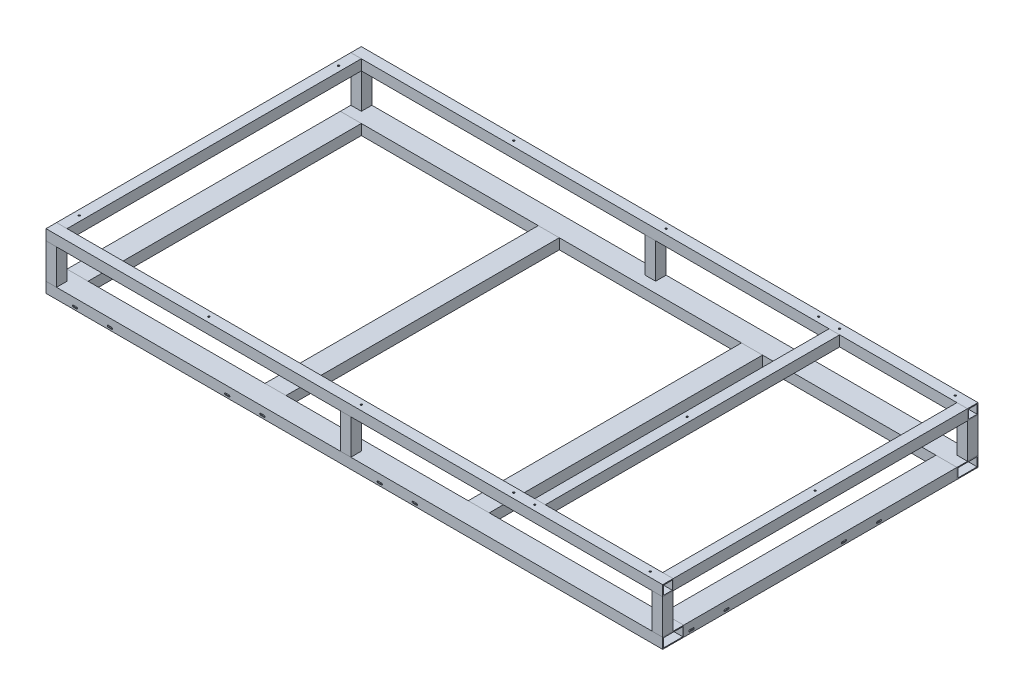
from build123d import *

# Parameters (mm, degrees)
RECTANGULAR_TUBE_1_5_X_3_X_125_2_OUTLIN_W = 76.2
RECTANGULAR_TUBE_1_5_X_3_X_125_2_OUTLIN_H = 990.6
RECTANGULAR_TUBE_1_5_X_3_X_125_2_DEPTH    = 3.175
RECTANGULAR_START                         = 34.925
RECTANGULAR_TUBE_1_5_X_3_X_125_2_2_OUTL_W = 76.2
RECTANGULAR_TUBE_1_5_X_3_X_125_2_2_OUTL_H = 990.6
RECTANGULAR_TUBE_1_5_X_3_X_125_2_2_DEPTH  = 3.175
RECTANGULAR_START_2                       = 3.175
RECTANGULAR_TUBE_1_5_X_3_X_125_2_3_OUTL_W = 3.175
RECTANGULAR_TUBE_1_5_X_3_X_125_2_3_OUTL_H = 990.6
RECTANGULAR_TUBE_1_5_X_3_X_125_2_3_DEPTH  = 31.75
RECTANGULAR_TUBE_1_5_X_3_X_125_2_4_OUTL_W = 76.2
RECTANGULAR_TUBE_1_5_X_3_X_125_2_4_OUTL_H = 990.6
RECTANGULAR_TUBE_1_5_X_3_X_125_2_4_DEPTH  = 3.175
RECTANGULAR_TUBE_1_5_X_3_X_125_2_5_OUTL_W = 76.2
RECTANGULAR_TUBE_1_5_X_3_X_125_2_5_OUTL_H = 990.6
RECTANGULAR_TUBE_1_5_X_3_X_125_2_5_DEPTH  = 3.175
RECTANGULAR_TUBE_1_5_X_3_X_125_2_6_OUTL_W = 3.175
RECTANGULAR_TUBE_1_5_X_3_X_125_2_6_OUTL_H = 990.6
RECTANGULAR_TUBE_1_5_X_3_X_125_2_6_DEPTH  = 31.75
RECTANGULAR_TUBE_1_5_X_3_X_125_2_7_OUTL_W = 2235.2
RECTANGULAR_TUBE_1_5_X_3_X_125_2_7_OUTL_H = 76.2
RECTANGULAR_TUBE_1_5_X_3_X_125_2_7_DEPTH  = 3.175
RECTANGULAR_TUBE_1_5_X_3_X_125_2_8_OUTL_W = 2235.2
RECTANGULAR_TUBE_1_5_X_3_X_125_2_8_OUTL_H = 76.2
RECTANGULAR_TUBE_1_5_X_3_X_125_2_8_DEPTH  = 3.175
RECTANGULAR_TUBE_1_5_X_3_X_125_2_9_OUTL_W = 2235.2
RECTANGULAR_TUBE_1_5_X_3_X_125_2_9_OUTL_H = 3.175
RECTANGULAR_TUBE_1_5_X_3_X_125_2_9_DEPTH  = 31.75
RECTANGULAR_TUBE_1_5_X_3_X_125_2_10_OUT_W = 2235.2
RECTANGULAR_TUBE_1_5_X_3_X_125_2_10_OUT_H = 76.2
RECTANGULAR_TUBE_1_5_X_3_X_125_2_10_DEPTH = 3.175
RECTANGULAR_TUBE_1_5_X_3_X_125_2_11_OUT_W = 2235.2
RECTANGULAR_TUBE_1_5_X_3_X_125_2_11_OUT_H = 76.2
RECTANGULAR_TUBE_1_5_X_3_X_125_2_11_DEPTH = 3.175
RECTANGULAR_TUBE_1_5_X_3_X_125_2_12_OUT_W = 2235.2
RECTANGULAR_TUBE_1_5_X_3_X_125_2_12_OUT_H = 3.175
RECTANGULAR_TUBE_1_5_X_3_X_125_2_12_DEPTH = 31.75
SQUARE_START                              = 533.4
SQUARE_TUBE_1_5_X_1_5_X_125_5_OUTLINE_W   = 2235.2
SQUARE_TUBE_1_5_X_1_5_X_125_5_OUTLINE_H   = 3.175
SQUARE_TUBE_1_5_X_1_5_X_125_5_DEPTH       = 38.1
SQUARE_TUBE_1_5_X_1_5_X_125_5_2_OUTLINE_W = 2235.2
SQUARE_TUBE_1_5_X_1_5_X_125_5_2_OUTLINE_H = 31.75
SQUARE_TUBE_1_5_X_1_5_X_125_5_2_DEPTH     = 3.175
SQUARE_START_2                            = 568.325
SQUARE_TUBE_1_5_X_1_5_X_125_5_3_OUTLINE_W = 2235.2
SQUARE_TUBE_1_5_X_1_5_X_125_5_3_OUTLINE_H = 31.75
SQUARE_TUBE_1_5_X_1_5_X_125_5_3_DEPTH     = 3.175
SQUARE_START_3                            = -1117.6
SQUARE_TUBE_1_5_X_1_5_X_125_5_4_OUTLINE_W = 3.175
SQUARE_TUBE_1_5_X_1_5_X_125_5_4_OUTLINE_H = 1066.8
SQUARE_TUBE_1_5_X_1_5_X_125_5_4_DEPTH     = 38.1
SQUARE_TUBE_1_5_X_1_5_X_125_5_5_OUTLINE_W = 31.75
SQUARE_TUBE_1_5_X_1_5_X_125_5_5_OUTLINE_H = 1066.8
SQUARE_TUBE_1_5_X_1_5_X_125_5_5_DEPTH     = 3.175
SQUARE_START_4                            = -1082.675
SQUARE_TUBE_1_5_X_1_5_X_125_5_6_OUTLINE_W = 31.75
SQUARE_TUBE_1_5_X_1_5_X_125_5_6_OUTLINE_H = 1066.8
SQUARE_TUBE_1_5_X_1_5_X_125_5_6_DEPTH     = 3.175
SQUARE_START_5                            = 1079.5
SQUARE_TUBE_1_5_X_1_5_X_125_5_7_OUTLINE_W = 3.175
SQUARE_TUBE_1_5_X_1_5_X_125_5_7_OUTLINE_H = 1066.8
SQUARE_TUBE_1_5_X_1_5_X_125_5_7_DEPTH     = 38.1
SQUARE_TUBE_1_5_X_1_5_X_125_5_8_OUTLINE_W = 31.75
SQUARE_TUBE_1_5_X_1_5_X_125_5_8_OUTLINE_H = 1066.8
SQUARE_TUBE_1_5_X_1_5_X_125_5_8_DEPTH     = 3.175
SQUARE_START_6                            = 1114.425
SQUARE_TUBE_1_5_X_1_5_X_125_5_9_OUTLINE_W = 31.75
SQUARE_TUBE_1_5_X_1_5_X_125_5_9_OUTLINE_H = 1066.8
SQUARE_TUBE_1_5_X_1_5_X_125_5_9_DEPTH     = 3.175
SQUARE_START_7                            = -571.5
SQUARE_TUBE_1_5_X_1_5_X_125_5_10_OUTLIN_W = 2235.2
SQUARE_TUBE_1_5_X_1_5_X_125_5_10_OUTLIN_H = 3.175
SQUARE_TUBE_1_5_X_1_5_X_125_5_10_DEPTH    = 38.1
SQUARE_TUBE_1_5_X_1_5_X_125_5_11_OUTLIN_W = 2235.2
SQUARE_TUBE_1_5_X_1_5_X_125_5_11_OUTLIN_H = 31.75
SQUARE_TUBE_1_5_X_1_5_X_125_5_11_DEPTH    = 3.175
SQUARE_START_8                            = -536.575
SQUARE_TUBE_1_5_X_1_5_X_125_5_12_OUTLIN_W = 2235.2
SQUARE_TUBE_1_5_X_1_5_X_125_5_12_OUTLIN_H = 31.75
SQUARE_TUBE_1_5_X_1_5_X_125_5_12_DEPTH    = 3.175
SKETCH112_W                               = 38.1
SKETCH112_H                               = 38.1
SKETCH112_W_2                             = 31.75
SKETCH112_H_2                             = 31.75
SQUARE_TUBE_1_5_X_1_5_X_125_6_DEPTH       = 203.2
SKETCH113_W                               = 38.1
SKETCH113_H                               = 38.1
SKETCH113_W_2                             = 31.75
SKETCH113_H_2                             = 31.75
SQUARE_TUBE_1_5_X_1_5_X_125_7_DEPTH       = 203.2
SKETCH114_W                               = 38.1
SKETCH114_H                               = 38.1
SKETCH114_W_2                             = 31.75
SKETCH114_H_2                             = 31.75
SQUARE_TUBE_1_5_X_1_5_X_125_8_DEPTH       = 203.2
SKETCH115_W                               = 38.1
SKETCH115_H                               = 38.1
SKETCH115_W_2                             = 31.75
SKETCH115_H_2                             = 31.75
SQUARE_TUBE_1_5_X_1_5_X_125_9_DEPTH       = 203.2
SKETCH127_W                               = 38.1
SKETCH127_H                               = 38.1
SKETCH127_W_2                             = 31.75
SKETCH127_H_2                             = 31.75
SQUARE_TUBE_1_5_X_1_5_X_125_32_DEPTH      = 1066.8
F_START                                   = 165.1
F_0_257_DIAMETER_HOLE1_OUTLINE_R          = 3.2639
F_0_257_DIAMETER_HOLE1_DEPTH              = 38.1
SKETCH151_W                               = 38.1
SKETCH151_H                               = 76.2
SKETCH151_W_2                             = 31.75
SKETCH151_H_2                             = 69.85
RECTANGULAR_TUBE_1_5_X_3_X_125_1_DEPTH    = 990.6
SKETCH151_ON_SEGMENT_2_W                  = 38.1
SKETCH151_ON_SEGMENT_2_H                  = 76.2
SKETCH151_ON_SEGMENT_2_W_2                = 31.75
SKETCH151_ON_SEGMENT_2_H_2                = 69.85
RECTANGULAR_TUBE_1_5_X_3_X_125_1_2_DEPTH  = 990.6
SKETCH157_W                               = 38.1
SKETCH157_H                               = 38.1
SKETCH157_W_2                             = 31.75
SKETCH157_H_2                             = 31.75
SQUARE_TUBE_1_5_X_1_5_X_125_96_DEPTH      = 127
F_0_257_START                             = 568.325
F_0_257_DIAMETER_HOLE1_2_DEPTH            = 3.175
F_START_2                                 = 1114.425
F_0_257_DIAMETER_SLOT4_DEPTH              = 3.175


# Read off the part's stored shape, not the designer's step: Rectangular tube 1.5 X 3 X .125_2_, Square tube 1.5 X 1.5 X .125_5_, F _0.257_ Diameter Hole1,  _0.257_ Diameter Hole1, F _0.257_ Diameter Slot4
with BuildPart() as part:
    # Rectangular tube 1.5 X 3 X .125(2) outlin → Rectangular tube 1.5 X 3 X .125(2) (new body)
    with BuildSketch(Plane(origin=(0, 0, 0), x_dir=(1, 0, 0), z_dir=(0, 1, 0))):
        with Locations((1079.5, 0)):
            Rectangle(RECTANGULAR_TUBE_1_5_X_3_X_125_2_OUTLIN_W, RECTANGULAR_TUBE_1_5_X_3_X_125_2_OUTLIN_H)
    extrude(amount=RECTANGULAR_TUBE_1_5_X_3_X_125_2_DEPTH)

    # Rectangular tube 1.5 X 3 X .125_2 2 outl → Rectangular tube 1.5 X 3 X .125_2 2 (add)
    with BuildSketch(Plane(origin=(0, 0, 0), x_dir=(1, 0, 0), z_dir=(0, 1, 0)).offset(RECTANGULAR_START)):
        with Locations((1079.5, 0)):
            Rectangle(RECTANGULAR_TUBE_1_5_X_3_X_125_2_2_OUTL_W, RECTANGULAR_TUBE_1_5_X_3_X_125_2_2_OUTL_H)
    extrude(amount=RECTANGULAR_TUBE_1_5_X_3_X_125_2_2_DEPTH)

    # Rectangular tube 1.5 X 3 X .125_2 3 outl → Rectangular tube 1.5 X 3 X .125_2 3 (add)
    with BuildSketch(Plane(origin=(0, 0, 0), x_dir=(1, 0, 0), z_dir=(0, 1, 0)).offset(RECTANGULAR_START_2)):
        with Locations((1042.9875, 0)):
            Rectangle(RECTANGULAR_TUBE_1_5_X_3_X_125_2_3_OUTL_W, RECTANGULAR_TUBE_1_5_X_3_X_125_2_3_OUTL_H)
        with Locations((1116.0125, 0)):
            Rectangle(RECTANGULAR_TUBE_1_5_X_3_X_125_2_3_OUTL_W, RECTANGULAR_TUBE_1_5_X_3_X_125_2_3_OUTL_H)
    extrude(amount=RECTANGULAR_TUBE_1_5_X_3_X_125_2_3_DEPTH)

    # F (0.257) Diameter Slot4 outline → F (0.257) Diameter Slot4 (cut)
    with BuildSketch(Plane.YZ.offset(F_START_2)):
        with BuildLine():
            Line((12.7889, -218.9861), (12.7889, -206.4639))
            ThreePointArc((12.7889, -206.4639), (9.525, -203.2), (6.2611, -206.4639))
            Line((6.2611, -206.4639), (6.2611, -218.9861))
            ThreePointArc((6.2611, -218.9861), (9.525, -222.25), (12.7889, -218.9861))
        make_face()
        with BuildLine():
            ThreePointArc((12.7889, -79.4639), (9.525, -76.2), (6.2611, -79.4639))
            Line((6.2611, -79.4639), (6.2611, -91.9861))
            ThreePointArc((6.2611, -91.9861), (9.525, -95.25), (12.7889, -91.9861))
            Line((12.7889, -91.9861), (12.7889, -79.4639))
        make_face()
        with BuildLine():
            ThreePointArc((12.7889, 472.9861), (9.525, 476.25), (6.2611, 472.9861))
            Line((6.2611, 472.9861), (6.2611, 460.4639))
            ThreePointArc((6.2611, 460.4639), (9.525, 457.2), (12.7889, 460.4639))
            Line((12.7889, 460.4639), (12.7889, 472.9861))
        make_face()
        with BuildLine():
            ThreePointArc((12.7889, 345.9861), (9.525, 349.25), (6.2611, 345.9861))
            Line((6.2611, 345.9861), (6.2611, 333.4639))
            ThreePointArc((6.2611, 333.4639), (9.525, 330.2), (12.7889, 333.4639))
            Line((12.7889, 333.4639), (12.7889, 345.9861))
        make_face()
    extrude(amount=F_0_257_DIAMETER_SLOT4_DEPTH, mode=Mode.SUBTRACT)


with BuildPart() as body_2:
    # Rectangular tube 1.5 X 3 X .125_2 4 outl → Rectangular tube 1.5 X 3 X .125_2 4 (new body)
    with BuildSketch(Plane(origin=(0, 0, 0), x_dir=(1, 0, 0), z_dir=(0, 1, 0))):
        with Locations((-1079.5, 0)):
            Rectangle(RECTANGULAR_TUBE_1_5_X_3_X_125_2_4_OUTL_W, RECTANGULAR_TUBE_1_5_X_3_X_125_2_4_OUTL_H)
    extrude(amount=RECTANGULAR_TUBE_1_5_X_3_X_125_2_4_DEPTH)

    # Rectangular tube 1.5 X 3 X .125_2 5 outl → Rectangular tube 1.5 X 3 X .125_2 5 (add)
    with BuildSketch(Plane(origin=(0, 0, 0), x_dir=(1, 0, 0), z_dir=(0, 1, 0)).offset(RECTANGULAR_START)):
        with Locations((-1079.5, 0)):
            Rectangle(RECTANGULAR_TUBE_1_5_X_3_X_125_2_5_OUTL_W, RECTANGULAR_TUBE_1_5_X_3_X_125_2_5_OUTL_H)
    extrude(amount=RECTANGULAR_TUBE_1_5_X_3_X_125_2_5_DEPTH)

    # Rectangular tube 1.5 X 3 X .125_2 6 outl → Rectangular tube 1.5 X 3 X .125_2 6 (add)
    with BuildSketch(Plane(origin=(0, 0, 0), x_dir=(1, 0, 0), z_dir=(0, 1, 0)).offset(RECTANGULAR_START_2)):
        with Locations((-1042.9875, 0)):
            Rectangle(RECTANGULAR_TUBE_1_5_X_3_X_125_2_6_OUTL_W, RECTANGULAR_TUBE_1_5_X_3_X_125_2_6_OUTL_H)
        with Locations((-1116.0125, 0)):
            Rectangle(RECTANGULAR_TUBE_1_5_X_3_X_125_2_6_OUTL_W, RECTANGULAR_TUBE_1_5_X_3_X_125_2_6_OUTL_H)
    extrude(amount=RECTANGULAR_TUBE_1_5_X_3_X_125_2_6_DEPTH)


with BuildPart() as body_3:
    # Rectangular tube 1.5 X 3 X .125_2 7 outl → Rectangular tube 1.5 X 3 X .125_2 7 (new body)
    with BuildSketch(Plane(origin=(0, 0, 0), x_dir=(1, 0, 0), z_dir=(0, 1, 0))):
        with Locations((0, 533.4)):
            Rectangle(RECTANGULAR_TUBE_1_5_X_3_X_125_2_7_OUTL_W, RECTANGULAR_TUBE_1_5_X_3_X_125_2_7_OUTL_H)
    extrude(amount=RECTANGULAR_TUBE_1_5_X_3_X_125_2_7_DEPTH)

    # Rectangular tube 1.5 X 3 X .125_2 8 outl → Rectangular tube 1.5 X 3 X .125_2 8 (add)
    with BuildSketch(Plane(origin=(0, 0, 0), x_dir=(1, 0, 0), z_dir=(0, 1, 0)).offset(RECTANGULAR_START)):
        with Locations((0, 533.4)):
            Rectangle(RECTANGULAR_TUBE_1_5_X_3_X_125_2_8_OUTL_W, RECTANGULAR_TUBE_1_5_X_3_X_125_2_8_OUTL_H)
    extrude(amount=RECTANGULAR_TUBE_1_5_X_3_X_125_2_8_DEPTH)

    # Rectangular tube 1.5 X 3 X .125_2 9 outl → Rectangular tube 1.5 X 3 X .125_2 9 (add)
    with BuildSketch(Plane(origin=(0, 0, 0), x_dir=(1, 0, 0), z_dir=(0, 1, 0)).offset(RECTANGULAR_START_2)):
        with Locations((0, 496.8875)):
            Rectangle(RECTANGULAR_TUBE_1_5_X_3_X_125_2_9_OUTL_W, RECTANGULAR_TUBE_1_5_X_3_X_125_2_9_OUTL_H)
        with Locations((0, 569.9125)):
            Rectangle(RECTANGULAR_TUBE_1_5_X_3_X_125_2_9_OUTL_W, RECTANGULAR_TUBE_1_5_X_3_X_125_2_9_OUTL_H)
    extrude(amount=RECTANGULAR_TUBE_1_5_X_3_X_125_2_9_DEPTH)


with BuildPart() as body_4:
    # Rectangular tube 1.5 X 3 X .125_2 10 out → Rectangular tube 1.5 X 3 X .125_2 10 (new body)
    with BuildSketch(Plane(origin=(0, 0, 0), x_dir=(1, 0, 0), z_dir=(0, 1, 0))):
        with Locations((0, -533.4)):
            Rectangle(RECTANGULAR_TUBE_1_5_X_3_X_125_2_10_OUT_W, RECTANGULAR_TUBE_1_5_X_3_X_125_2_10_OUT_H)
    extrude(amount=RECTANGULAR_TUBE_1_5_X_3_X_125_2_10_DEPTH)

    # Rectangular tube 1.5 X 3 X .125_2 11 out → Rectangular tube 1.5 X 3 X .125_2 11 (add)
    with BuildSketch(Plane(origin=(0, 0, 0), x_dir=(1, 0, 0), z_dir=(0, 1, 0)).offset(RECTANGULAR_START)):
        with Locations((0, -533.4)):
            Rectangle(RECTANGULAR_TUBE_1_5_X_3_X_125_2_11_OUT_W, RECTANGULAR_TUBE_1_5_X_3_X_125_2_11_OUT_H)
    extrude(amount=RECTANGULAR_TUBE_1_5_X_3_X_125_2_11_DEPTH)

    # Rectangular tube 1.5 X 3 X .125_2 12 out → Rectangular tube 1.5 X 3 X .125_2 12 (add)
    with BuildSketch(Plane(origin=(0, 0, 0), x_dir=(1, 0, 0), z_dir=(0, 1, 0)).offset(RECTANGULAR_START_2)):
        with Locations((0, -496.8875)):
            Rectangle(RECTANGULAR_TUBE_1_5_X_3_X_125_2_12_OUT_W, RECTANGULAR_TUBE_1_5_X_3_X_125_2_12_OUT_H)
        with Locations((0, -569.9125)):
            Rectangle(RECTANGULAR_TUBE_1_5_X_3_X_125_2_12_OUT_W, RECTANGULAR_TUBE_1_5_X_3_X_125_2_12_OUT_H)
    extrude(amount=RECTANGULAR_TUBE_1_5_X_3_X_125_2_12_DEPTH)

    # 0.257_ Diameter Hole1 2 outline → 0.257_ Diameter Hole1 2 (cut)
    with BuildSketch(Plane.XY.offset(F_0_257_START)):
        with BuildLine():
            Line((212.8139, 6.2611), (225.3361, 6.2611))
            ThreePointArc((225.3361, 6.2611), (228.6, 9.525), (225.3361, 12.7889))
            Line((225.3361, 12.7889), (212.8139, 12.7889))
            ThreePointArc((212.8139, 12.7889), (209.55, 9.525), (212.8139, 6.2611))
        make_face()
        with BuildLine():
            ThreePointArc((98.3361, 6.2611), (101.6, 9.525), (98.3361, 12.7889))
            Line((98.3361, 12.7889), (85.8139, 12.7889))
            ThreePointArc((85.8139, 12.7889), (82.55, 9.525), (85.8139, 6.2611))
            Line((85.8139, 6.2611), (98.3361, 6.2611))
        make_face()
        with BuildLine():
            ThreePointArc((-327.1139, 6.2611), (-323.85, 9.525), (-327.1139, 12.7889))
            Line((-327.1139, 12.7889), (-339.6361, 12.7889))
            ThreePointArc((-339.6361, 12.7889), (-342.9, 9.525), (-339.6361, 6.2611))
            Line((-339.6361, 6.2611), (-327.1139, 6.2611))
        make_face()
        with BuildLine():
            ThreePointArc((-454.1139, 6.2611), (-450.85, 9.525), (-454.1139, 12.7889))
            Line((-454.1139, 12.7889), (-466.6361, 12.7889))
            ThreePointArc((-466.6361, 12.7889), (-469.9, 9.525), (-466.6361, 6.2611))
            Line((-466.6361, 6.2611), (-454.1139, 6.2611))
        make_face()
        with BuildLine():
            ThreePointArc((-879.5639, 6.2611), (-876.3, 9.525), (-879.5639, 12.7889))
            Line((-879.5639, 12.7889), (-892.0861, 12.7889))
            ThreePointArc((-892.0861, 12.7889), (-895.35, 9.525), (-892.0861, 6.2611))
            Line((-892.0861, 6.2611), (-879.5639, 6.2611))
        make_face()
        with BuildLine():
            ThreePointArc((-1006.5639, 6.2611), (-1003.3, 9.525), (-1006.5639, 12.7889))
            Line((-1006.5639, 12.7889), (-1019.0861, 12.7889))
            ThreePointArc((-1019.0861, 12.7889), (-1022.35, 9.525), (-1019.0861, 6.2611))
            Line((-1019.0861, 6.2611), (-1006.5639, 6.2611))
        make_face()
    f_0_257_diameter_hole1_2 = extrude(amount=F_0_257_DIAMETER_HOLE1_2_DEPTH, mode=Mode.SUBTRACT)


with BuildPart() as body_5:
    # Square tube 1.5 X 1.5 X .125(5) outline → Square tube 1.5 X 1.5 X .125(5) (new body)
    with BuildSketch(Plane.XY.offset(SQUARE_START)):
        with Locations((0, 201.6125)):
            Rectangle(SQUARE_TUBE_1_5_X_1_5_X_125_5_OUTLINE_W, SQUARE_TUBE_1_5_X_1_5_X_125_5_OUTLINE_H)
        with Locations((0, 166.6875)):
            Rectangle(SQUARE_TUBE_1_5_X_1_5_X_125_5_OUTLINE_W, SQUARE_TUBE_1_5_X_1_5_X_125_5_OUTLINE_H)
    extrude(amount=SQUARE_TUBE_1_5_X_1_5_X_125_5_DEPTH)

    # Square tube 1.5 X 1.5 X .125_5 2 outline → Square tube 1.5 X 1.5 X .125_5 2 (add)
    with BuildSketch(Plane.XY.offset(SQUARE_START)):
        with Locations((0, 184.15)):
            Rectangle(SQUARE_TUBE_1_5_X_1_5_X_125_5_2_OUTLINE_W, SQUARE_TUBE_1_5_X_1_5_X_125_5_2_OUTLINE_H)
    extrude(amount=SQUARE_TUBE_1_5_X_1_5_X_125_5_2_DEPTH)

    # Square tube 1.5 X 1.5 X .125_5 3 outline → Square tube 1.5 X 1.5 X .125_5 3 (add)
    with BuildSketch(Plane.XY.offset(SQUARE_START_2)):
        with Locations((0, 184.15)):
            Rectangle(SQUARE_TUBE_1_5_X_1_5_X_125_5_3_OUTLINE_W, SQUARE_TUBE_1_5_X_1_5_X_125_5_3_OUTLINE_H)
    extrude(amount=SQUARE_TUBE_1_5_X_1_5_X_125_5_3_DEPTH)


with BuildPart() as body_6:
    # Square tube 1.5 X 1.5 X .125_5 4 outline → Square tube 1.5 X 1.5 X .125_5 4 (new body)
    with BuildSketch(Plane.YZ.offset(SQUARE_START_3)):
        with Locations((166.6875, 0)):
            Rectangle(SQUARE_TUBE_1_5_X_1_5_X_125_5_4_OUTLINE_W, SQUARE_TUBE_1_5_X_1_5_X_125_5_4_OUTLINE_H)
        with Locations((201.6125, 0)):
            Rectangle(SQUARE_TUBE_1_5_X_1_5_X_125_5_4_OUTLINE_W, SQUARE_TUBE_1_5_X_1_5_X_125_5_4_OUTLINE_H)
    extrude(amount=SQUARE_TUBE_1_5_X_1_5_X_125_5_4_DEPTH)

    # Square tube 1.5 X 1.5 X .125_5 5 outline → Square tube 1.5 X 1.5 X .125_5 5 (add)
    with BuildSketch(Plane.YZ.offset(SQUARE_START_3)):
        with Locations((184.15, 0)):
            Rectangle(SQUARE_TUBE_1_5_X_1_5_X_125_5_5_OUTLINE_W, SQUARE_TUBE_1_5_X_1_5_X_125_5_5_OUTLINE_H)
    extrude(amount=SQUARE_TUBE_1_5_X_1_5_X_125_5_5_DEPTH)

    # Square tube 1.5 X 1.5 X .125_5 6 outline → Square tube 1.5 X 1.5 X .125_5 6 (add)
    with BuildSketch(Plane.YZ.offset(SQUARE_START_4)):
        with Locations((184.15, 0)):
            Rectangle(SQUARE_TUBE_1_5_X_1_5_X_125_5_6_OUTLINE_W, SQUARE_TUBE_1_5_X_1_5_X_125_5_6_OUTLINE_H)
    extrude(amount=SQUARE_TUBE_1_5_X_1_5_X_125_5_6_DEPTH)


with BuildPart() as body_7:
    # Square tube 1.5 X 1.5 X .125_5 7 outline → Square tube 1.5 X 1.5 X .125_5 7 (new body)
    with BuildSketch(Plane.YZ.offset(SQUARE_START_5)):
        with Locations((166.6875, 0)):
            Rectangle(SQUARE_TUBE_1_5_X_1_5_X_125_5_7_OUTLINE_W, SQUARE_TUBE_1_5_X_1_5_X_125_5_7_OUTLINE_H)
        with Locations((201.6125, 0)):
            Rectangle(SQUARE_TUBE_1_5_X_1_5_X_125_5_7_OUTLINE_W, SQUARE_TUBE_1_5_X_1_5_X_125_5_7_OUTLINE_H)
    extrude(amount=SQUARE_TUBE_1_5_X_1_5_X_125_5_7_DEPTH)

    # Square tube 1.5 X 1.5 X .125_5 8 outline → Square tube 1.5 X 1.5 X .125_5 8 (add)
    with BuildSketch(Plane.YZ.offset(SQUARE_START_5)):
        with Locations((184.15, 0)):
            Rectangle(SQUARE_TUBE_1_5_X_1_5_X_125_5_8_OUTLINE_W, SQUARE_TUBE_1_5_X_1_5_X_125_5_8_OUTLINE_H)
    extrude(amount=SQUARE_TUBE_1_5_X_1_5_X_125_5_8_DEPTH)

    # Square tube 1.5 X 1.5 X .125_5 9 outline → Square tube 1.5 X 1.5 X .125_5 9 (add)
    with BuildSketch(Plane.YZ.offset(SQUARE_START_6)):
        with Locations((184.15, 0)):
            Rectangle(SQUARE_TUBE_1_5_X_1_5_X_125_5_9_OUTLINE_W, SQUARE_TUBE_1_5_X_1_5_X_125_5_9_OUTLINE_H)
    extrude(amount=SQUARE_TUBE_1_5_X_1_5_X_125_5_9_DEPTH)


with BuildPart() as body_8:
    # Square tube 1.5 X 1.5 X .125_5 10 outlin → Square tube 1.5 X 1.5 X .125_5 10 (new body)
    with BuildSketch(Plane.XY.offset(SQUARE_START_7)):
        with Locations((0, 201.6125)):
            Rectangle(SQUARE_TUBE_1_5_X_1_5_X_125_5_10_OUTLIN_W, SQUARE_TUBE_1_5_X_1_5_X_125_5_10_OUTLIN_H)
        with Locations((0, 166.6875)):
            Rectangle(SQUARE_TUBE_1_5_X_1_5_X_125_5_10_OUTLIN_W, SQUARE_TUBE_1_5_X_1_5_X_125_5_10_OUTLIN_H)
    extrude(amount=SQUARE_TUBE_1_5_X_1_5_X_125_5_10_DEPTH)

    # Square tube 1.5 X 1.5 X .125_5 11 outlin → Square tube 1.5 X 1.5 X .125_5 11 (add)
    with BuildSketch(Plane.XY.offset(SQUARE_START_7)):
        with Locations((0, 184.15)):
            Rectangle(SQUARE_TUBE_1_5_X_1_5_X_125_5_11_OUTLIN_W, SQUARE_TUBE_1_5_X_1_5_X_125_5_11_OUTLIN_H)
    extrude(amount=SQUARE_TUBE_1_5_X_1_5_X_125_5_11_DEPTH)

    # Square tube 1.5 X 1.5 X .125_5 12 outlin → Square tube 1.5 X 1.5 X .125_5 12 (add)
    with BuildSketch(Plane.XY.offset(SQUARE_START_8)):
        with Locations((0, 184.15)):
            Rectangle(SQUARE_TUBE_1_5_X_1_5_X_125_5_12_OUTLIN_W, SQUARE_TUBE_1_5_X_1_5_X_125_5_12_OUTLIN_H)
    extrude(amount=SQUARE_TUBE_1_5_X_1_5_X_125_5_12_DEPTH)


with BuildPart() as body_9:
    # Sketch112 → Square tube 1.5 X 1.5 X .125(6) (new body)
    with BuildSketch(Plane(origin=(-1098.55, 203.2, 552.45), x_dir=(-1, 0, 0), z_dir=(0, -1, 0))):
        Rectangle(SKETCH112_W, SKETCH112_H)
        Rectangle(SKETCH112_W_2, SKETCH112_H_2, mode=Mode.SUBTRACT)
    extrude(amount=SQUARE_TUBE_1_5_X_1_5_X_125_6_DEPTH)

    # Trim/Extend2
    split(bisect_by=Plane(origin=(-1098.55, 165.1, 0), x_dir=(1, 0, 0), z_dir=(0, -1, 0)), keep=Keep.TOP)

    # Trim_Extend2 5
    split(bisect_by=Plane(origin=(0, 38.1, -533.4), x_dir=(-1, 0, 0), z_dir=(0, 1, 0)), keep=Keep.TOP)


with BuildPart() as body_10:
    # Sketch113 → Square tube 1.5 X 1.5 X .125(7) (new body)
    with BuildSketch(Plane(origin=(-1098.55, 203.2, -552.45), x_dir=(-1, 0, 0), z_dir=(0, -1, 0))):
        Rectangle(SKETCH113_W, SKETCH113_H)
        Rectangle(SKETCH113_W_2, SKETCH113_H_2, mode=Mode.SUBTRACT)
    extrude(amount=SQUARE_TUBE_1_5_X_1_5_X_125_7_DEPTH)

    # Trim/Extend2
    split(bisect_by=Plane(origin=(-1098.55, 165.1, 0), x_dir=(1, 0, 0), z_dir=(0, -1, 0)), keep=Keep.TOP)

    # Trim_Extend2 5
    split(bisect_by=Plane(origin=(0, 38.1, -533.4), x_dir=(-1, 0, 0), z_dir=(0, 1, 0)), keep=Keep.TOP)


with BuildPart() as body_11:
    # Sketch114 → Square tube 1.5 X 1.5 X .125(8) (new body)
    with BuildSketch(Plane(origin=(1098.55, 203.2, -552.45), x_dir=(-1, 0, 0), z_dir=(0, -1, 0))):
        Rectangle(SKETCH114_W, SKETCH114_H)
        Rectangle(SKETCH114_W_2, SKETCH114_H_2, mode=Mode.SUBTRACT)
    extrude(amount=SQUARE_TUBE_1_5_X_1_5_X_125_8_DEPTH)

    # Trim/Extend2
    split(bisect_by=Plane(origin=(-1098.55, 165.1, 0), x_dir=(1, 0, 0), z_dir=(0, -1, 0)), keep=Keep.TOP)

    # Trim_Extend2 5
    split(bisect_by=Plane(origin=(0, 38.1, -533.4), x_dir=(-1, 0, 0), z_dir=(0, 1, 0)), keep=Keep.TOP)


with BuildPart() as body_12:
    # Sketch115 → Square tube 1.5 X 1.5 X .125(9) (new body)
    with BuildSketch(Plane(origin=(1098.55, 203.2, 552.45), x_dir=(-1, 0, 0), z_dir=(0, -1, 0))):
        Rectangle(SKETCH115_W, SKETCH115_H)
        Rectangle(SKETCH115_W_2, SKETCH115_H_2, mode=Mode.SUBTRACT)
    extrude(amount=SQUARE_TUBE_1_5_X_1_5_X_125_9_DEPTH)

    # Trim/Extend2
    split(bisect_by=Plane(origin=(-1098.55, 165.1, 0), x_dir=(1, 0, 0), z_dir=(0, -1, 0)), keep=Keep.TOP)

    # Trim_Extend2 5
    split(bisect_by=Plane(origin=(0, 38.1, -533.4), x_dir=(-1, 0, 0), z_dir=(0, 1, 0)), keep=Keep.TOP)


with BuildPart() as body_13:
    # Sketch127 → Square tube 1.5 X 1.5 X .125(32) (new body)
    with BuildSketch(Plane(origin=(635, 184.15, -533.4), x_dir=(1, 0, 0), z_dir=(0, 0, 1))):
        Rectangle(SKETCH127_W, SKETCH127_H)
        Rectangle(SKETCH127_W_2, SKETCH127_H_2, mode=Mode.SUBTRACT)
    extrude(amount=SQUARE_TUBE_1_5_X_1_5_X_125_32_DEPTH)


with BuildPart() as f_0_257_diameter_hole1_tool:
    # F (0.257) Diameter Hole1 outline → F (0.257) Diameter Hole1 (new body)
    with BuildSketch(Plane(origin=(0, 0, 0), x_dir=(1, 0, 0), z_dir=(0, 1, 0)).offset(F_START)):
        with Locations((635, 0)):
            Circle(F_0_257_DIAMETER_HOLE1_OUTLINE_R)
        with Locations((1054.1, -552.45)):
            Circle(F_0_257_DIAMETER_HOLE1_OUTLINE_R)
        with Locations((635, -552.45)):
            Circle(F_0_257_DIAMETER_HOLE1_OUTLINE_R)
        with Locations((558.8, -552.45)):
            Circle(F_0_257_DIAMETER_HOLE1_OUTLINE_R)
        with Locations((6.35, -552.45)):
            Circle(F_0_257_DIAMETER_HOLE1_OUTLINE_R)
        with Locations((-546.1, -552.45)):
            Circle(F_0_257_DIAMETER_HOLE1_OUTLINE_R)
        with Locations((-1098.55, 469.9)):
            Circle(F_0_257_DIAMETER_HOLE1_OUTLINE_R)
        with Locations((-1098.55, -469.9)):
            Circle(F_0_257_DIAMETER_HOLE1_OUTLINE_R)
        with Locations((1098.55, 0)):
            Circle(F_0_257_DIAMETER_HOLE1_OUTLINE_R)
        with Locations((6.35, 552.45)):
            Circle(F_0_257_DIAMETER_HOLE1_OUTLINE_R)
        with Locations((1054.1, 552.45)):
            Circle(F_0_257_DIAMETER_HOLE1_OUTLINE_R)
        with Locations((635, 552.45)):
            Circle(F_0_257_DIAMETER_HOLE1_OUTLINE_R)
        with Locations((-546.1, 552.45)):
            Circle(F_0_257_DIAMETER_HOLE1_OUTLINE_R)
        with Locations((558.8, 552.45)):
            Circle(F_0_257_DIAMETER_HOLE1_OUTLINE_R)
    extrude(amount=F_0_257_DIAMETER_HOLE1_DEPTH)


with BuildPart() as body_5_1:
    add(body_5.part)

    # F (0.257) Diameter Hole1: cut by f_0_257_diameter_hole1_tool
    add(f_0_257_diameter_hole1_tool.part, mode=Mode.SUBTRACT)


with BuildPart() as body_6_1:
    add(body_6.part)

    # F (0.257) Diameter Hole1: cut by f_0_257_diameter_hole1_tool
    add(f_0_257_diameter_hole1_tool.part, mode=Mode.SUBTRACT)


with BuildPart() as body_7_1:
    add(body_7.part)

    # F (0.257) Diameter Hole1: cut by f_0_257_diameter_hole1_tool
    add(f_0_257_diameter_hole1_tool.part, mode=Mode.SUBTRACT)


with BuildPart() as body_8_1:
    add(body_8.part)

    # F (0.257) Diameter Hole1: cut by f_0_257_diameter_hole1_tool
    add(f_0_257_diameter_hole1_tool.part, mode=Mode.SUBTRACT)


with BuildPart() as body_13_1:
    add(body_13.part)

    # F (0.257) Diameter Hole1: cut by f_0_257_diameter_hole1_tool
    add(f_0_257_diameter_hole1_tool.part, mode=Mode.SUBTRACT)


with BuildPart() as body_14:
    # Sketch151 → Rectangular tube 1.5 X 3 X .125(1) (new body)
    with BuildSketch(Plane(origin=(-361.95, 19.05, -495.3), x_dir=(0, 1, 0), z_dir=(0, 0, 1))):
        Rectangle(SKETCH151_W, SKETCH151_H)
        Rectangle(SKETCH151_W_2, SKETCH151_H_2, mode=Mode.SUBTRACT)
    extrude(amount=RECTANGULAR_TUBE_1_5_X_3_X_125_1_DEPTH)


with BuildPart() as body_15:
    # Sketch151 on segment 2 (carried to segment 2) → Rectangular tube 1.5 X 3 X .125_1 2 (new body)
    with BuildSketch(Plane(origin=(374.65, 19.05, -495.3), x_dir=(0, 1, 0), z_dir=(0, 0, 1))):
        Rectangle(SKETCH151_ON_SEGMENT_2_W, SKETCH151_ON_SEGMENT_2_H)
        Rectangle(SKETCH151_ON_SEGMENT_2_W_2, SKETCH151_ON_SEGMENT_2_H_2, mode=Mode.SUBTRACT)
    extrude(amount=RECTANGULAR_TUBE_1_5_X_3_X_125_1_2_DEPTH)


with BuildPart() as body_16:
    # Sketch157 → Square tube 1.5 X 1.5 X .125(96) (new body)
    with BuildSketch(Plane(origin=(-31.75, 38.1, 552.45), x_dir=(-1, 0, 0), z_dir=(0, 1, 0))):
        Rectangle(SKETCH157_W, SKETCH157_H)
        Rectangle(SKETCH157_W_2, SKETCH157_H_2, mode=Mode.SUBTRACT)
    extrude(amount=SQUARE_TUBE_1_5_X_1_5_X_125_96_DEPTH)


with BuildPart() as body_17:
    # Mirror1: mirrored copy
    add(body_16.part.mirror(Plane.XY))


with BuildPart() as body_3_1:
    add(body_3.part)

    # Mirror2: 0.257_ Diameter Hole1 2 across plane
    add(f_0_257_diameter_hole1_2.mirror(Plane.XY), mode=Mode.SUBTRACT)


solid = Compound([part.part, body_2.part, body_4.part, body_9.part, body_10.part, body_11.part, body_12.part, body_5_1.part, body_6_1.part, body_7_1.part, body_8_1.part, body_13_1.part, body_14.part, body_15.part, body_16.part, body_17.part, body_3_1.part])
